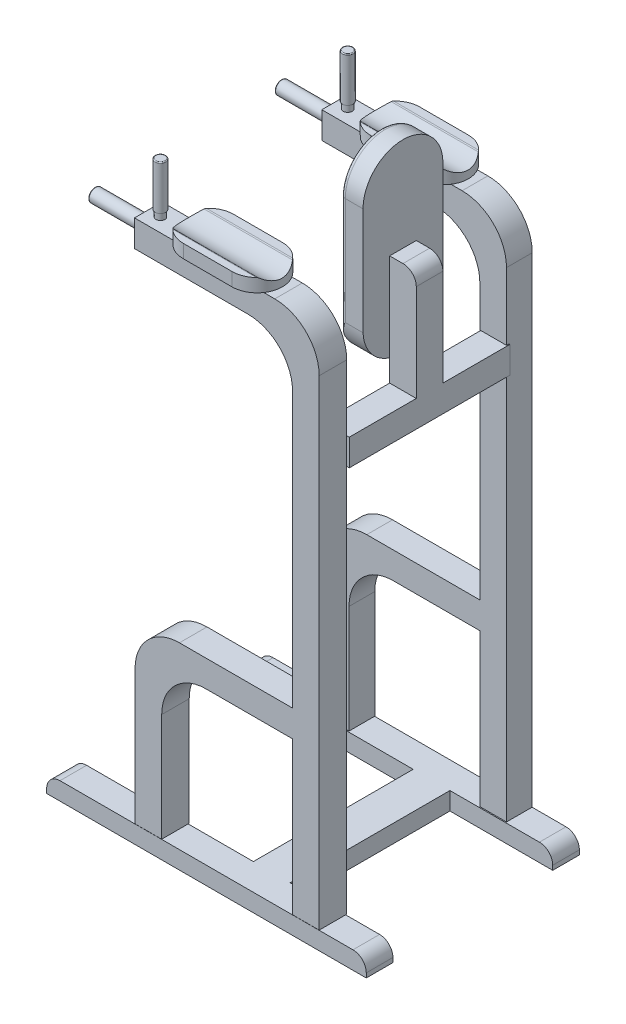
from build123d import *

# Parameters (mm, degrees)
BOSS_EXTRUDE1_DEPTH     = 50.8
FILLET1_R               = 38.1
BOSS_EXTRUDE2_DEPTH     = 609.6
CUT_EXTRUDE1_DEPTH      = 1772.314885724
CUT_EXTRUDE1_DEPTH_BACK = 1772.314885724
SKETCH3_W               = 457.2
SKETCH3_H               = 1503.586356282
BOSS_EXTRUDE3_DEPTH     = 76.2
BOSS_EXTRUDE4_DEPTH     = 63.5
SKETCH8_W               = 76.2
SKETCH8_H               = 76.2
BOSS_EXTRUDE5_DEPTH     = 152.4
FILLET2_R               = 38.1
FILLET3_R               = 12.7
SKETCH9_R               = 12.7
BOSS_EXTRUDE6_DEPTH     = 19.05
SKETCH10_R              = 15.24
BOSS_EXTRUDE7_DEPTH     = 127
FILLET5_R               = 2.54
FILLET6_R               = 2.54
BOSS_EXTRUDE9_DEPTH     = 38.1
SKETCH12_R              = 79.852773965
SKETCH12_R_2            = 79.756
CUT_EXTRUDE2_DEPTH      = 457.2
FILLET7_R               = 6.35
FILLET8_R               = 6.35
SKETCH13_R              = 19.05
BOSS_EXTRUDE10_DEPTH    = 152.4
FILLET9_R               = 2.54
FILLET10_R              = 2.54


with BuildPart() as part:
    # Sketch1 → Boss-Extrude1 (new body)
    with BuildSketch(Plane(origin=(0, 0, 0), x_dir=(1, 0, 0), z_dir=(0, 1, 0))):
        Polygon((0, 0), (0, 76.2), (914.4, 76.2), (914.4, 0), (620.389380531, 0), (620.389380531, -457.2), (914.4, -457.2), (914.4, -533.4), (0, -533.4), (0, -457.2), (515.192920354, -457.2), (515.192920354, 0), align=None)
    extrude(amount=BOSS_EXTRUDE1_DEPTH)

    # Fillet1
    fillet1_edges = [part.edges().sort_by_distance(p)[0] for p in [
        (0, 50.8, 495.3),
        (914.4, 50.8, 495.3),
        (914.4, 50.8, -38.1),
        (0, 50.8, -38.1),
    ]]
    fillet(fillet1_edges, radius=FILLET1_R)


with BuildPart() as body_2:
    # Sketch2 → Boss-Extrude2 (new body)
    with BuildSketch(Plane.XY.offset(535.94)):
        with BuildLine():
            Line((331.655543923, 53.781220657), (331.655543923, 362.636524537))
            ThreePointArc((331.655543923, 362.636524537), (368.852982713, 452.439085747), (458.655543923, 489.636524537))
            Line((458.655543923, 489.636524537), (706.005521127, 489.636524537))
            Line((706.005521127, 489.636524537), (706.005521127, 53.781220657))
            Line((706.005521127, 53.781220657), (782.205521127, 53.781220657))
            Line((782.205521127, 53.781220657), (782.205521127, 1427.386356282))
            ThreePointArc((782.205521127, 1427.386356282), (745.008082337, 1517.188917492), (655.205521127, 1554.386356282))
            Line((655.205521127, 1554.386356282), (253.809910121, 1554.386356282))
            Line((253.809910121, 1554.386356282), (253.809910121, 1478.186356282))
            Line((253.809910121, 1478.186356282), (579.005521127, 1478.186356282))
            ThreePointArc((579.005521127, 1478.186356282), (668.808082337, 1440.988917492), (706.005521127, 1351.186356282))
            Line((706.005521127, 1351.186356282), (706.005521127, 565.836524537))
            Line((706.005521127, 565.836524537), (382.455543923, 565.836524537))
            ThreePointArc((382.455543923, 565.836524537), (292.652982713, 528.639085747), (255.455543923, 438.836524537))
            Line((255.455543923, 438.836524537), (255.455543923, 53.781220657))
            Line((255.455543923, 53.781220657), (331.655543923, 53.781220657))
        make_face()
    extrude(amount=-BOSS_EXTRUDE2_DEPTH)

    # Sketch3 → Cut-Extrude1 (cut, two sides: drawn at the far end of the back side and taken through both)
    with BuildSketch(Plane.ZY.offset(-255.455543923).offset(-CUT_EXTRUDE1_DEPTH_BACK)):
        with Locations((228.6, 802.593178141)):
            Rectangle(SKETCH3_W, SKETCH3_H)
    extrude(amount=CUT_EXTRUDE1_DEPTH + CUT_EXTRUDE1_DEPTH_BACK, mode=Mode.SUBTRACT)


with BuildPart() as cut_extrude1_piece_1:
    # of the separate pieces the step leaves, piece 1, a body of its own (cut_extrude1_pieces)
    add(body_2.part.solids().sort_by_distance((331.655543923, 53.781220657, 535.94))[0])



with BuildPart() as cut_extrude1_piece_2:
    # of the separate pieces the step leaves, piece 2, a body of its own (cut_extrude1_pieces)
    add(body_2.part.solids().sort_by_distance((331.655543923, 53.781220657, 0))[0])

    # Sketch6 → Boss-Extrude3 (add)
    with BuildSketch(Plane(origin=(784.745521127, 0, 0), x_dir=(0, 0, -1), z_dir=(1, 0, 0))):
        Polygon((7.355677628, 1234.749002317), (-184.414322372, 1234.749002317), (-184.414322372, 1397.530562675), (-260.614322372, 1397.530562675), (-260.614322372, 1234.749002317), (-452.384322372, 1234.749002317), (-452.384322372, 1158.549002317), (7.355677628, 1158.549002317), align=None)
    extrude(amount=-BOSS_EXTRUDE3_DEPTH)

    # Sketch7 → Boss-Extrude4 (add)
    with BuildSketch(Plane.ZY.offset(-708.545521127)):
        with BuildLine():
            Line((108.214322372, 1397.530562675), (108.214322372, 1704.586856831))
            ThreePointArc((108.214322372, 1704.586856831), (222.514322372, 1818.886856831), (336.814322372, 1704.586856831))
            Line((336.814322372, 1704.586856831), (336.814322372, 1397.530562675))
            ThreePointArc((336.814322372, 1397.530562675), (301.510618654, 1321.116632813), (222.514322372, 1292.047313129))
            ThreePointArc((222.514322372, 1292.047313129), (143.518026089, 1321.116632813), (108.214322372, 1397.530562675))
        make_face()
    extrude(amount=BOSS_EXTRUDE4_DEPTH)

    # Sketch8 → Boss-Extrude5 (add)
    with BuildSketch(Plane(origin=(0, 1397.530562675, 0), x_dir=(1, 0, 0), z_dir=(0, 1, 0))):
        with Locations((746.645521127, -222.514322372)):
            Rectangle(SKETCH8_W, SKETCH8_H)
    extrude(amount=BOSS_EXTRUDE5_DEPTH)

    # Fillet2
    fillet2_edges = [cut_extrude1_piece_2.edges().sort_by_distance(p)[0] for p in [
        (784.745521127, 1549.930562675, 222.514322372),
    ]]
    fillet(fillet2_edges, radius=FILLET2_R)

    # Fillet3
    # the kernel refuses this fillet: 12.7 mm, written as the material it takes off along each edge
    with BuildSketch(Plane(origin=(645.045521127, 1704.586856831, 336.814322372), x_dir=(1, 0, 0), z_dir=(0, -1, 0)), Plane(origin=(645.045521127, 1321.330562675, 108.214322372), x_dir=(1, 0, 0), z_dir=(0, 1, 0))) as fillet3_piece_1:
        with BuildLine():
            CenterArc((FILLET3_R, -FILLET3_R), FILLET3_R, 90, 90)
            Line((0, -FILLET3_R), (-FILLET3_R * 0.02, -FILLET3_R))
            Line((-FILLET3_R * 0.02, -FILLET3_R), (-FILLET3_R * 0.02, FILLET3_R * 0.02))
            Line((-FILLET3_R * 0.02, FILLET3_R * 0.02), (FILLET3_R, FILLET3_R * 0.02))
            Line((FILLET3_R, FILLET3_R * 0.02), (FILLET3_R, 0))
        make_face()
    extrude(amount=383.256294156, mode=Mode.SUBTRACT)
    with BuildSketch(Plane(origin=(645.045521127, 1704.586856831, 222.514322372), x_dir=(0, 0, -1), z_dir=(0, -1, 0))) as fillet3_piece_2:
        with BuildLine():
            CenterArc((114.3 - FILLET3_R, FILLET3_R), FILLET3_R, 270, 90)
            Line((114.3 - FILLET3_R, 0), (114.3 - FILLET3_R, -FILLET3_R * 0.02))
            Line((114.3 - FILLET3_R, -FILLET3_R * 0.02), (114.3 + FILLET3_R * 0.02, -FILLET3_R * 0.02))
            Line((114.3 + FILLET3_R * 0.02, -FILLET3_R * 0.02), (114.3 + FILLET3_R * 0.02, FILLET3_R))
            Line((114.3 + FILLET3_R * 0.02, FILLET3_R), (114.3, FILLET3_R))
        make_face()
    revolve(axis=Axis((645.045521127, 1704.586856831, 222.514322372), (1, 0, 0)), revolution_arc=180, mode=Mode.SUBTRACT)


with BuildPart() as cut_extrude1_piece_1_1:
    add(cut_extrude1_piece_1.part)

    add(cut_extrude1_piece_2.part)  # Boss-Extrude6 merges Cut-Extrude1 piece 2
    # Sketch9 → Boss-Extrude6 (add)
    with BuildSketch(Plane(origin=(0, 1554.386356282, 0), x_dir=(1, 0, 0), z_dir=(0, 1, 0))):
        with Locations(Location((288.59973389, 39.37, 0), (0, 0, 90))):
            Circle(SKETCH9_R)
        with Locations(Location((288.59973389, -496.57, 0), (0, 0, 90))):
            Circle(SKETCH9_R)
    extrude(amount=BOSS_EXTRUDE6_DEPTH)

    # Sketch10 → Boss-Extrude7 (add)
    with BuildSketch(Plane(origin=(0, 1573.436356282, 0), x_dir=(1, 0, 0), z_dir=(0, 1, 0))):
        with Locations(Location((288.59973389, 39.37, 0), (0, 0, 270))):
            Circle(SKETCH10_R)
        with Locations(Location((288.59973389, -496.57, 0), (0, 0, 270))):
            Circle(SKETCH10_R)
    extrude(amount=BOSS_EXTRUDE7_DEPTH)

    # Fillet5
    fillet5_edges = [cut_extrude1_piece_1_1.edges().sort_by_distance(p)[0] for p in [
        (288.59973389, 1700.436356282, 481.33),
    ]]
    fillet(fillet5_edges, radius=FILLET5_R)

    # Fillet6
    fillet6_edges = [cut_extrude1_piece_1_1.edges().sort_by_distance(p)[0] for p in [
        (288.59973389, 1700.436356282, -54.61),
    ]]
    fillet(fillet6_edges, radius=FILLET6_R)

    # Sketch11 → Boss-Extrude9 (add)
    with BuildSketch(Plane(origin=(0, 1554.386356282, 0), x_dir=(1, 0, 0), z_dir=(0, 1, 0))):
        with BuildLine():
            Line((424.802842495, 108.848559152), (564.359854125, 108.848559152))
            ThreePointArc((564.359854125, 108.848559152), (634.749573683, 38.458839593), (564.359854125, -31.930879965))
            Line((564.359854125, -31.930879965), (424.802842495, -31.930879965))
            ThreePointArc((424.802842495, -31.930879965), (354.413122937, 38.458839593), (424.802842495, 108.848559152))
        make_face()
        with BuildLine():
            Line((424.802842495, -423.360383503), (564.359854125, -423.360383503))
            ThreePointArc((564.359854125, -423.360383503), (636.377876725, -495.378406103), (564.359854125, -567.396428703))
            Line((564.359854125, -567.396428703), (424.802842495, -567.396428703))
            ThreePointArc((424.802842495, -567.396428703), (352.784819895, -495.378406103), (424.802842495, -423.360383503))
        make_face()
    extrude(amount=BOSS_EXTRUDE9_DEPTH)

    # Sketch12 → Cut-Extrude2 (cut)
    with BuildSketch(Plane(origin=(784.745521127, 0, 0), x_dir=(0, 0, -1), z_dir=(1, 0, 0))):
        with Locations((-497.51685526, 1656.331288898)):
            Circle(SKETCH12_R)
        with Locations((36.207560504, 1656.331288898)):
            Circle(SKETCH12_R_2)
    extrude(amount=-CUT_EXTRUDE2_DEPTH, mode=Mode.SUBTRACT)

    # Fillet7
    fillet7_edges = [cut_extrude1_piece_1_1.edges().sort_by_distance(p)[0] for p in [
        (494.58134831, 1592.486356282, 11.592482542),
        (494.58134831, 1592.486356282, -84.007603551),
    ]]
    fillet(fillet7_edges, radius=FILLET7_R)

    # Fillet8
    fillet8_edges = [cut_extrude1_piece_1_1.edges().sort_by_distance(p)[0] for p in [
        (494.58134831, 1592.486356282, 545.478194786),
        (494.58134831, 1592.486356282, 449.555515734),
    ]]
    fillet(fillet8_edges, radius=FILLET8_R)

    # Sketch13 → Boss-Extrude10 (add)
    with BuildSketch(Plane.ZY.offset(-253.809910121)):
        with Locations(Location((-36.83, 1516.286356282, 0), (0, 0, 180))):
            Circle(SKETCH13_R)
        with Locations(Location((496.57, 1516.286356282, 0), (0, 0, 180))):
            Circle(SKETCH13_R)
    extrude(amount=BOSS_EXTRUDE10_DEPTH)

    # Fillet9
    fillet9_edges = [cut_extrude1_piece_1_1.edges().sort_by_distance(p)[0] for p in [
        (101.409910121, 1516.286356282, -17.78),
    ]]
    fillet(fillet9_edges, radius=FILLET9_R)

    # Fillet10
    fillet10_edges = [cut_extrude1_piece_1_1.edges().sort_by_distance(p)[0] for p in [
        (101.409910121, 1516.286356282, 515.62),
    ]]
    fillet(fillet10_edges, radius=FILLET10_R)


solid = Compound([part.part, cut_extrude1_piece_1_1.part])
